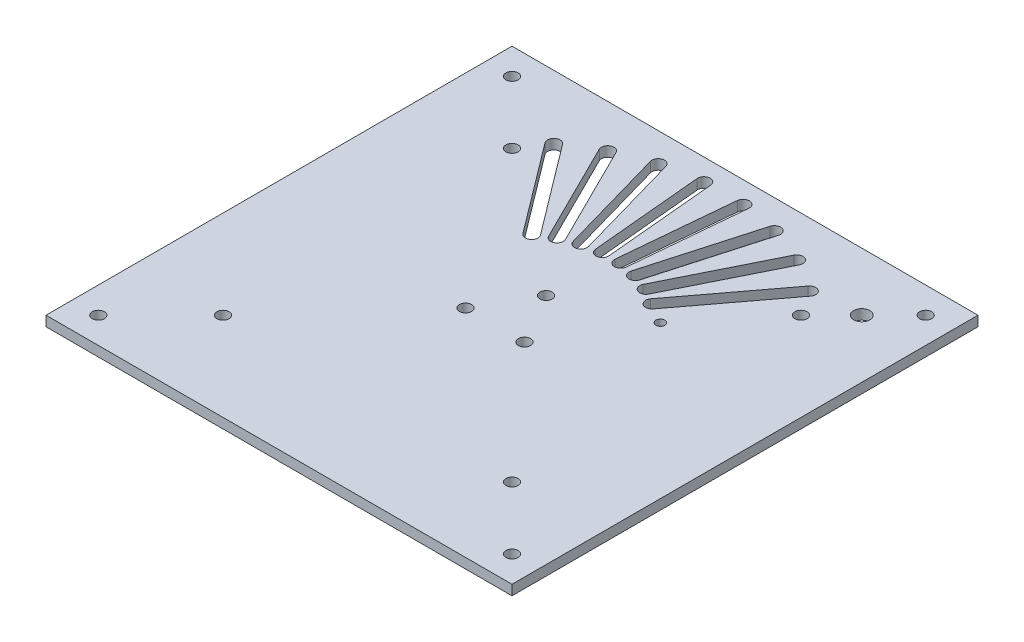
from build123d import *

# Parameters (mm, degrees)
SKETCH2_W                 = 130
SKETCH2_H                 = 130
BOSS_EXTRUDE1_DEPTH       = 2.8
CORNERPIECE_HOLES_REACH   = 93.967
SKETCH4_R                 = 1.7
CUT_EXTRUDE2_REACH        = 93.967
SKETCH6_R                 = 1.7
CUT_EXTRUDE3_REACH        = 93.967
SKETCH8_R                 = 1.7
PRIMARY_WIRE_HOLE_REACH   = 93.967
SKETCH9_R                 = 2.25
SECONDARY_WIRE_HOLE_REACH = 93.967
SKETCH10_R                = 1.25
CUT_EXTRUDE6_REACH        = 93.967


with BuildPart() as part:
    # Sketch2 → Boss-Extrude1 (new body)
    with BuildSketch(Plane(origin=(0, 0, 0), x_dir=(1, 0, 0), z_dir=(0, 1, 0))):
        Rectangle(SKETCH2_W, SKETCH2_H)
    extrude(amount=BOSS_EXTRUDE1_DEPTH)

    # Sketch4 → Cornerpiece holes (cut, up to next)
    with BuildSketch(Plane(origin=(0, 2.8, 0), x_dir=(1, 0, 0), z_dir=(0, 1, 0)), mode=Mode.PRIVATE) as cornerpiece_holes_sk1:
        with Locations((-57.7, 57.7)):
            Circle(SKETCH4_R)
    cornerpiece_holes_tool1 = extrude(cornerpiece_holes_sk1.sketch, amount=-CORNERPIECE_HOLES_REACH, mode=Mode.PRIVATE) & part.part
    # Sketch4 → Cornerpiece holes (cut, up to next)
    with BuildSketch(Plane(origin=(0, 2.8, 0), x_dir=(1, 0, 0), z_dir=(0, 1, 0)), mode=Mode.PRIVATE) as cornerpiece_holes_sk2:
        with Locations((57.7, 57.7)):
            Circle(SKETCH4_R)
    cornerpiece_holes_tool2 = extrude(cornerpiece_holes_sk2.sketch, amount=-CORNERPIECE_HOLES_REACH, mode=Mode.PRIVATE) & part.part
    # Sketch4 → Cornerpiece holes (cut, up to next)
    with BuildSketch(Plane(origin=(0, 2.8, 0), x_dir=(1, 0, 0), z_dir=(0, 1, 0)), mode=Mode.PRIVATE) as cornerpiece_holes_sk3:
        with Locations((57.7, -57.7)):
            Circle(SKETCH4_R)
    cornerpiece_holes_tool3 = extrude(cornerpiece_holes_sk3.sketch, amount=-CORNERPIECE_HOLES_REACH, mode=Mode.PRIVATE) & part.part
    # Sketch4 → Cornerpiece holes (cut, up to next)
    with BuildSketch(Plane(origin=(0, 2.8, 0), x_dir=(1, 0, 0), z_dir=(0, 1, 0)), mode=Mode.PRIVATE) as cornerpiece_holes_sk4:
        with Locations((-57.7, -57.7)):
            Circle(SKETCH4_R)
    cornerpiece_holes_tool4 = extrude(cornerpiece_holes_sk4.sketch, amount=-CORNERPIECE_HOLES_REACH, mode=Mode.PRIVATE) & part.part
    add(cornerpiece_holes_tool1.solids().sort_by_distance((-57.7, 2.8, -57.7))[0], mode=Mode.SUBTRACT)
    add(cornerpiece_holes_tool2.solids().sort_by_distance((57.7, 2.8, -57.7))[0], mode=Mode.SUBTRACT)
    add(cornerpiece_holes_tool3.solids().sort_by_distance((57.7, 2.8, 57.7))[0], mode=Mode.SUBTRACT)
    add(cornerpiece_holes_tool4.solids().sort_by_distance((-57.7, 2.8, 57.7))[0], mode=Mode.SUBTRACT)

    # Sketch6 → Cut-Extrude2 (cut, up to next)
    with BuildSketch(Plane(origin=(0, 2.8, 0), x_dir=(1, 0, 0), z_dir=(0, 1, 0)), mode=Mode.PRIVATE) as cut_extrude2_sk1:
        with Locations((-40.305086528, 40.305086528)):
            Circle(SKETCH6_R)
    cut_extrude2_tool1 = extrude(cut_extrude2_sk1.sketch, amount=-CUT_EXTRUDE2_REACH, mode=Mode.PRIVATE) & part.part
    # Sketch6 → Cut-Extrude2 (cut, up to next)
    with BuildSketch(Plane(origin=(0, 2.8, 0), x_dir=(1, 0, 0), z_dir=(0, 1, 0)), mode=Mode.PRIVATE) as cut_extrude2_sk2:
        with Locations((40.305086528, 40.305086528)):
            Circle(SKETCH6_R)
    cut_extrude2_tool2 = extrude(cut_extrude2_sk2.sketch, amount=-CUT_EXTRUDE2_REACH, mode=Mode.PRIVATE) & part.part
    # Sketch6 → Cut-Extrude2 (cut, up to next)
    with BuildSketch(Plane(origin=(0, 2.8, 0), x_dir=(1, 0, 0), z_dir=(0, 1, 0)), mode=Mode.PRIVATE) as cut_extrude2_sk3:
        with Locations((40.305086528, -40.305086528)):
            Circle(SKETCH6_R)
    cut_extrude2_tool3 = extrude(cut_extrude2_sk3.sketch, amount=-CUT_EXTRUDE2_REACH, mode=Mode.PRIVATE) & part.part
    # Sketch6 → Cut-Extrude2 (cut, up to next)
    with BuildSketch(Plane(origin=(0, 2.8, 0), x_dir=(1, 0, 0), z_dir=(0, 1, 0)), mode=Mode.PRIVATE) as cut_extrude2_sk4:
        with Locations((-40.305086528, -40.305086528)):
            Circle(SKETCH6_R)
    cut_extrude2_tool4 = extrude(cut_extrude2_sk4.sketch, amount=-CUT_EXTRUDE2_REACH, mode=Mode.PRIVATE) & part.part
    add(cut_extrude2_tool1.solids().sort_by_distance((-40.305087, 2.8, -40.305087))[0], mode=Mode.SUBTRACT)
    add(cut_extrude2_tool2.solids().sort_by_distance((40.305087, 2.8, -40.305087))[0], mode=Mode.SUBTRACT)
    add(cut_extrude2_tool3.solids().sort_by_distance((40.305087, 2.8, 40.305087))[0], mode=Mode.SUBTRACT)
    add(cut_extrude2_tool4.solids().sort_by_distance((-40.305087, 2.8, 40.305087))[0], mode=Mode.SUBTRACT)

    # Sketch8 → Cut-Extrude3 (cut, up to next)
    with BuildSketch(Plane(origin=(0, 2.8, 0), x_dir=(1, 0, 0), z_dir=(0, 1, 0)), mode=Mode.PRIVATE) as cut_extrude3_sk1:
        with Locations((0, 9.5)):
            Circle(SKETCH8_R)
    cut_extrude3_tool1 = extrude(cut_extrude3_sk1.sketch, amount=-CUT_EXTRUDE3_REACH, mode=Mode.PRIVATE) & part.part
    # Sketch8 → Cut-Extrude3 (cut, up to next)
    with BuildSketch(Plane(origin=(0, 2.8, 0), x_dir=(1, 0, 0), z_dir=(0, 1, 0)), mode=Mode.PRIVATE) as cut_extrude3_sk2:
        with Locations((8.227241336, -4.75)):
            Circle(SKETCH8_R)
    cut_extrude3_tool2 = extrude(cut_extrude3_sk2.sketch, amount=-CUT_EXTRUDE3_REACH, mode=Mode.PRIVATE) & part.part
    # Sketch8 → Cut-Extrude3 (cut, up to next)
    with BuildSketch(Plane(origin=(0, 2.8, 0), x_dir=(1, 0, 0), z_dir=(0, 1, 0)), mode=Mode.PRIVATE) as cut_extrude3_sk3:
        with Locations((-8.227241336, -4.75)):
            Circle(SKETCH8_R)
    cut_extrude3_tool3 = extrude(cut_extrude3_sk3.sketch, amount=-CUT_EXTRUDE3_REACH, mode=Mode.PRIVATE) & part.part
    add(cut_extrude3_tool1.solids().sort_by_distance((0, 2.8, -9.5))[0], mode=Mode.SUBTRACT)
    add(cut_extrude3_tool2.solids().sort_by_distance((8.227241, 2.8, 4.75))[0], mode=Mode.SUBTRACT)
    add(cut_extrude3_tool3.solids().sort_by_distance((-8.227241, 2.8, 4.75))[0], mode=Mode.SUBTRACT)

    # Sketch9 → Primary wire hole (cut, up to next)
    with BuildSketch(Plane(origin=(0, 2.8, 0), x_dir=(1, 0, 0), z_dir=(0, 1, 0)), mode=Mode.PRIVATE) as primary_wire_hole_sk1:
        with Locations((48.790367902, 48.790367902)):
            Circle(SKETCH9_R)
    primary_wire_hole_tool1 = extrude(primary_wire_hole_sk1.sketch, amount=-PRIMARY_WIRE_HOLE_REACH, mode=Mode.PRIVATE) & part.part
    add(primary_wire_hole_tool1.solids().sort_by_distance((48.790368, 2.8, -48.790368))[0], mode=Mode.SUBTRACT)

    # Sketch10 → Secondary wire hole (cut, up to next)
    with BuildSketch(Plane(origin=(0, 2.8, 0), x_dir=(1, 0, 0), z_dir=(0, 1, 0)), mode=Mode.PRIVATE) as secondary_wire_hole_sk1:
        with Locations((22.506385739, 18.885099973)):
            Circle(SKETCH10_R)
    secondary_wire_hole_tool1 = extrude(secondary_wire_hole_sk1.sketch, amount=-SECONDARY_WIRE_HOLE_REACH, mode=Mode.PRIVATE) & part.part
    add(secondary_wire_hole_tool1.solids().sort_by_distance((22.506386, 2.8, -18.8851))[0], mode=Mode.SUBTRACT)

    # Sketch11 → Cut-Extrude6 (cut, up to next)
    with BuildSketch(Plane(origin=(0, 2.8, 0), x_dir=(1, 0, 0), z_dir=(0, 1, 0)), mode=Mode.PRIVATE) as cut_extrude6_sk1:
        with BuildLine():
            Line((-34.259927979, 48.372330261), (-15.380990703, 23.319134311))
            ThreePointArc((-15.380990703, 23.319134311), (-15.725426555, 20.868345878), (-18.176214988, 21.21278173))
            Line((-18.176214988, 21.21278173), (-37.055152264, 46.26597768))
            ThreePointArc((-37.055152264, 46.26597768), (-36.710716412, 48.716766113), (-34.259927979, 48.372330261))
        make_face()
    cut_extrude6_tool1 = extrude(cut_extrude6_sk1.sketch, amount=-CUT_EXTRUDE6_REACH, mode=Mode.PRIVATE) & part.part
    # Sketch11 → Cut-Extrude6 (cut, up to next)
    with BuildSketch(Plane(origin=(0, 2.8, 0), x_dir=(1, 0, 0), z_dir=(0, 1, 0)), mode=Mode.PRIVATE) as cut_extrude6_sk2:
        with BuildLine():
            Line((-27.938203096, 52.278884913), (-13.975987518, 24.187365977))
            ThreePointArc((-13.975987518, 24.187365977), (-11.629987027, 23.399151731), (-10.841772782, 25.745152222))
            Line((-10.841772782, 25.745152222), (-24.80398836, 53.836671159))
            ThreePointArc((-24.80398836, 53.836671159), (-27.149988851, 54.624885404), (-27.938203096, 52.278884913))
        make_face()
    cut_extrude6_tool2 = extrude(cut_extrude6_sk2.sketch, amount=-CUT_EXTRUDE6_REACH, mode=Mode.PRIVATE) & part.part
    # Sketch11 → Cut-Extrude6 (cut, up to next)
    with BuildSketch(Plane(origin=(0, 2.8, 0), x_dir=(1, 0, 0), z_dir=(0, 1, 0)), mode=Mode.PRIVATE) as cut_extrude6_sk3:
        with BuildLine():
            Line((-17.87286129, 56.517128637), (-9.301329978, 26.340883824))
            ThreePointArc((-9.301329978, 26.340883824), (-7.139754963, 25.135647974), (-5.934519112, 27.297222989))
            Line((-5.934519112, 27.297222989), (-14.506050425, 57.473467801))
            ThreePointArc((-14.506050425, 57.473467801), (-16.667625439, 58.678703651), (-17.87286129, 56.517128637))
        make_face()
    cut_extrude6_tool3 = extrude(cut_extrude6_sk3.sketch, amount=-CUT_EXTRUDE6_REACH, mode=Mode.PRIVATE) & part.part
    # Sketch11 → Cut-Extrude6 (cut, up to next)
    with BuildSketch(Plane(origin=(0, 2.8, 0), x_dir=(1, 0, 0), z_dir=(0, 1, 0)), mode=Mode.PRIVATE) as cut_extrude6_sk4:
        with BuildLine():
            Line((-7.200805802, 58.836837065), (-4.310928692, 27.600231771))
            ThreePointArc((-4.310928692, 27.600231771), (-2.407156164, 26.018887355), (-0.825811748, 27.922659883))
            Line((-0.825811748, 27.922659883), (-3.715688858, 59.159265177))
            ThreePointArc((-3.715688858, 59.159265177), (-5.619461386, 60.740609593), (-7.200805802, 58.836837065))
        make_face()
    cut_extrude6_tool4 = extrude(cut_extrude6_sk4.sketch, amount=-CUT_EXTRUDE6_REACH, mode=Mode.PRIVATE) & part.part
    # Sketch11 → Cut-Extrude6 (cut, up to next)
    with BuildSketch(Plane(origin=(0, 2.8, 0), x_dir=(1, 0, 0), z_dir=(0, 1, 0)), mode=Mode.PRIVATE) as cut_extrude6_sk5:
        with BuildLine():
            Line((3.715688858, 59.159265177), (0.825811748, 27.922659883))
            ThreePointArc((0.825811748, 27.922659883), (2.407156164, 26.018887355), (4.310928692, 27.600231771))
            Line((4.310928692, 27.600231771), (7.200805802, 58.836837065))
            ThreePointArc((7.200805802, 58.836837065), (5.619461386, 60.740609593), (3.715688858, 59.159265177))
        make_face()
    cut_extrude6_tool5 = extrude(cut_extrude6_sk5.sketch, amount=-CUT_EXTRUDE6_REACH, mode=Mode.PRIVATE) & part.part
    # Sketch11 → Cut-Extrude6 (cut, up to next)
    with BuildSketch(Plane(origin=(0, 2.8, 0), x_dir=(1, 0, 0), z_dir=(0, 1, 0)), mode=Mode.PRIVATE) as cut_extrude6_sk6:
        with BuildLine():
            Line((14.506050425, 57.473467801), (5.934519112, 27.297222989))
            ThreePointArc((5.934519112, 27.297222989), (7.139754963, 25.135647974), (9.301329978, 26.340883824))
            Line((9.301329978, 26.340883824), (17.87286129, 56.517128637))
            ThreePointArc((17.87286129, 56.517128637), (16.667625439, 58.678703651), (14.506050425, 57.473467801))
        make_face()
    cut_extrude6_tool6 = extrude(cut_extrude6_sk6.sketch, amount=-CUT_EXTRUDE6_REACH, mode=Mode.PRIVATE) & part.part
    # Sketch11 → Cut-Extrude6 (cut, up to next)
    with BuildSketch(Plane(origin=(0, 2.8, 0), x_dir=(1, 0, 0), z_dir=(0, 1, 0)), mode=Mode.PRIVATE) as cut_extrude6_sk7:
        with BuildLine():
            Line((24.80398836, 53.836671159), (10.841772782, 25.745152222))
            ThreePointArc((10.841772782, 25.745152222), (11.629987027, 23.399151731), (13.975987518, 24.187365977))
            Line((13.975987518, 24.187365977), (27.938203096, 52.278884913))
            ThreePointArc((27.938203096, 52.278884913), (27.149988851, 54.624885404), (24.80398836, 53.836671159))
        make_face()
    cut_extrude6_tool7 = extrude(cut_extrude6_sk7.sketch, amount=-CUT_EXTRUDE6_REACH, mode=Mode.PRIVATE) & part.part
    # Sketch11 → Cut-Extrude6 (cut, up to next)
    with BuildSketch(Plane(origin=(0, 2.8, 0), x_dir=(1, 0, 0), z_dir=(0, 1, 0)), mode=Mode.PRIVATE) as cut_extrude6_sk8:
        with BuildLine():
            Line((34.259927979, 48.372330261), (15.380990703, 23.319134311))
            ThreePointArc((15.380990703, 23.319134311), (15.725426555, 20.868345878), (18.176214988, 21.21278173))
            Line((18.176214988, 21.21278173), (37.055152264, 46.26597768))
            ThreePointArc((37.055152264, 46.26597768), (36.710716412, 48.716766113), (34.259927979, 48.372330261))
        make_face()
    cut_extrude6_tool8 = extrude(cut_extrude6_sk8.sketch, amount=-CUT_EXTRUDE6_REACH, mode=Mode.PRIVATE) & part.part
    add(cut_extrude6_tool1.solids().sort_by_distance((-26.218071, 2.8, -34.792556))[0], mode=Mode.SUBTRACT)
    add(cut_extrude6_tool2.solids().sort_by_distance((-19.389988, 2.8, -39.012019))[0], mode=Mode.SUBTRACT)
    add(cut_extrude6_tool3.solids().sort_by_distance((-11.90369, 2.8, -41.907176))[0], mode=Mode.SUBTRACT)
    add(cut_extrude6_tool4.solids().sort_by_distance((-4.013309, 2.8, -43.379748))[0], mode=Mode.SUBTRACT)
    add(cut_extrude6_tool5.solids().sort_by_distance((4.013309, 2.8, -43.379748))[0], mode=Mode.SUBTRACT)
    add(cut_extrude6_tool6.solids().sort_by_distance((11.90369, 2.8, -41.907176))[0], mode=Mode.SUBTRACT)
    add(cut_extrude6_tool7.solids().sort_by_distance((19.389988, 2.8, -39.012019))[0], mode=Mode.SUBTRACT)
    add(cut_extrude6_tool8.solids().sort_by_distance((26.218071, 2.8, -34.792556))[0], mode=Mode.SUBTRACT)


solid = part.part
